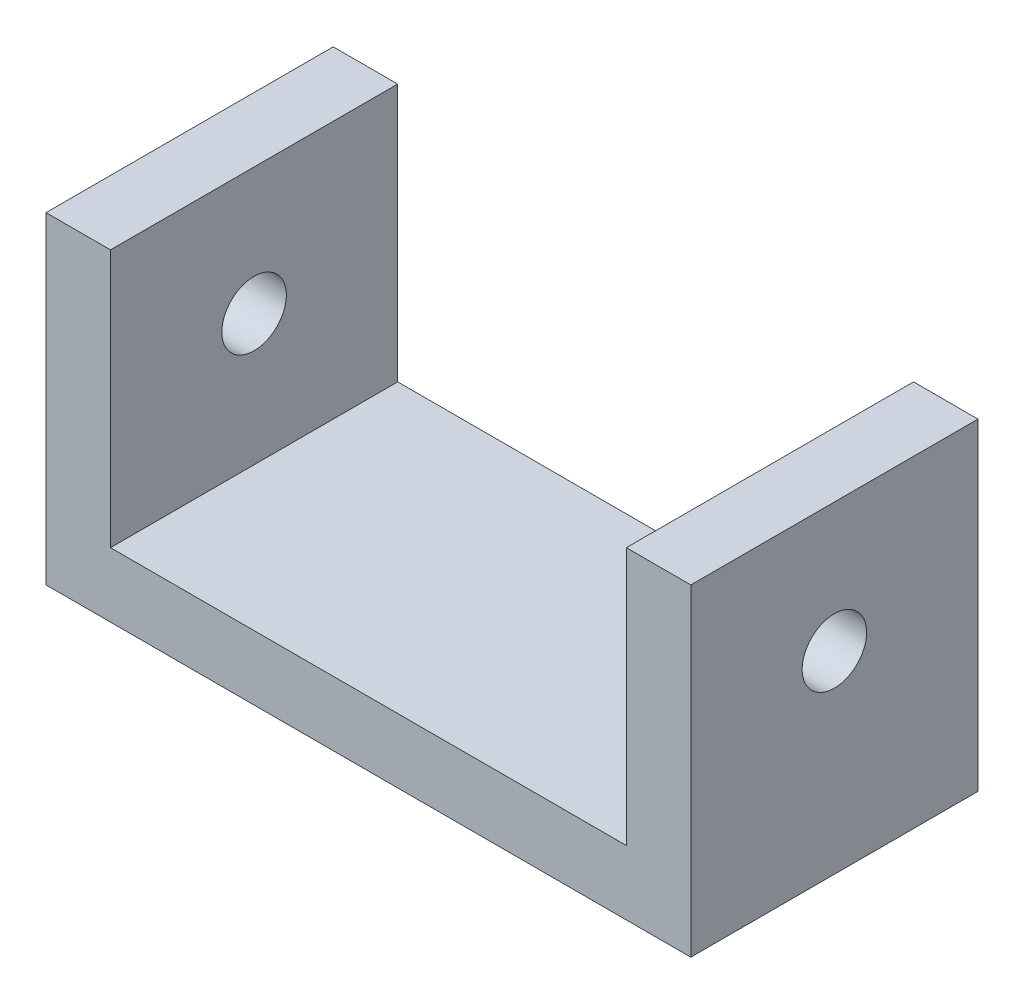
from build123d import *

# Parameters (mm, degrees)
SKETCH1_W           = 63.5
SKETCH1_H           = 28.284249084
BOSS_EXTRUDE1_DEPTH = 6.35
SKETCH2_W           = 6.35
SKETCH2_H           = 28.284249084
BOSS_EXTRUDE2_DEPTH = 25.4
SKETCH3_R           = 3.175
CUT_EXTRUDE1_DEPTH  = 6.35
SKETCH4_R           = 3.175
CUT_EXTRUDE2_DEPTH  = 7.62


with BuildPart() as part:
    # Sketch1 → Boss-Extrude1 (new body)
    with BuildSketch(Plane(origin=(0, 0, 0), x_dir=(1, 0, 0), z_dir=(0, 1, 0))):
        Rectangle(SKETCH1_W, SKETCH1_H)
    extrude(amount=BOSS_EXTRUDE1_DEPTH)

    # Sketch2 → Boss-Extrude2 (add)
    with BuildSketch(Plane(origin=(0, 6.35, 0), x_dir=(1, 0, 0), z_dir=(0, 1, 0))):
        with Locations((-28.575, 0)):
            Rectangle(SKETCH2_W, SKETCH2_H)
        with Locations((28.575, 0)):
            Rectangle(SKETCH2_W, SKETCH2_H)
    extrude(amount=BOSS_EXTRUDE2_DEPTH)

    # Sketch3 → Cut-Extrude1 (cut)
    with BuildSketch(Plane.ZY.offset(31.75)):
        with Locations((0, 19.247915812)):
            Circle(SKETCH3_R)
    extrude(amount=-CUT_EXTRUDE1_DEPTH, mode=Mode.SUBTRACT)

    # Sketch4 → Cut-Extrude2 (cut)
    with BuildSketch(Plane(origin=(31.75, 0, 0), x_dir=(0, 0, -1), z_dir=(1, 0, 0))):
        with Locations((0, 19.05)):
            Circle(SKETCH4_R)
    extrude(amount=-CUT_EXTRUDE2_DEPTH, mode=Mode.SUBTRACT)


solid = part.part
